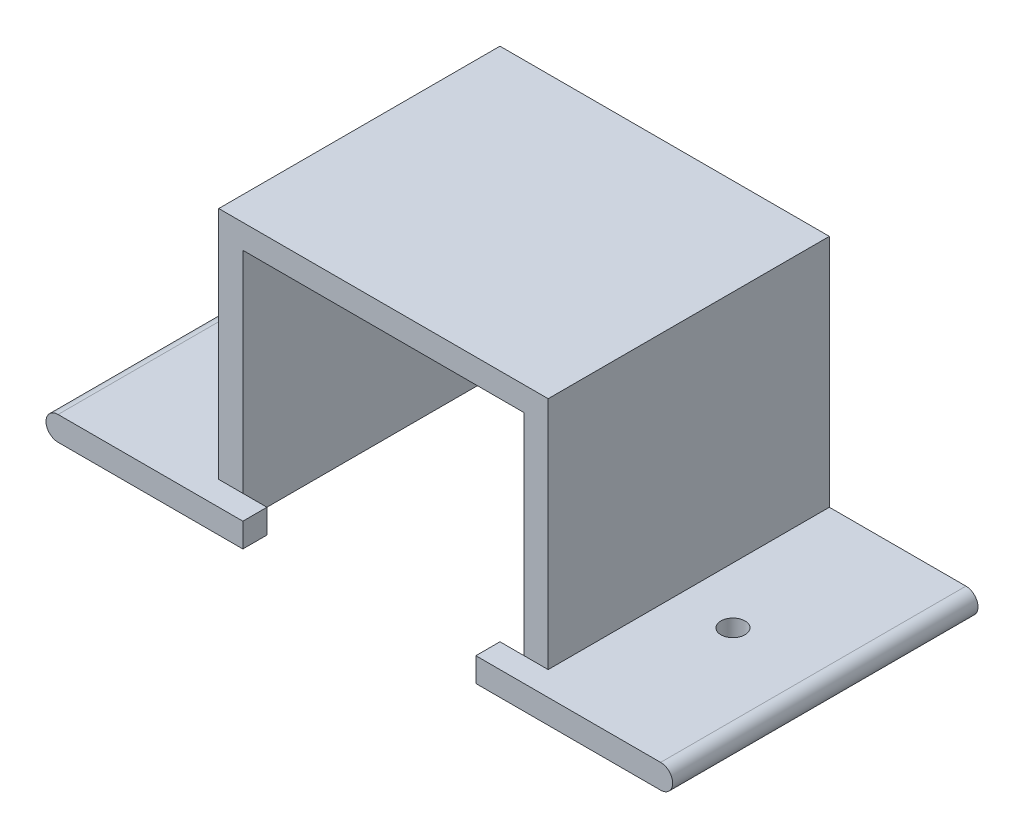
from build123d import *

# Parameters (mm, degrees)
BOSS_EXTRUDE1_DEPTH = 32
BOSS_EXTRUDE2_START = 3
BOSS_EXTRUDE2_DEPTH = 3
BOSS_EXTRUDE3_DEPTH = 3
SKETCH4_R           = 1.5
CUT_EXTRUDE1_DEPTH  = 4


with BuildPart() as part:
    # Sketch1 → Boss-Extrude1 (new body)
    with BuildSketch(Plane.XY):
        with BuildLine():
            Line((0, 0), (-20, 0))
            Line((-20, 0), (-20, 27.2))
            Line((-20, 27.2), (-20, 29.2))
            Line((-20, 29.2), (-55, 29.2))
            Line((-55, 29.2), (-55, 27.2))
            Line((-55, 27.2), (-55, 0))
            Line((-55, 0), (-75, 0))
            ThreePointArc((-75, 0), (-76.5, 1.5), (-75, 3))
            Line((-75, 3), (-58, 3))
            Line((-58, 3), (-58, 30.2))
            Line((-58, 30.2), (-58, 32.2))
            Line((-58, 32.2), (-17, 32.2))
            Line((-17, 32.2), (-17, 30.2))
            Line((-17, 30.2), (-17, 3))
            Line((-17, 3), (0, 3))
            ThreePointArc((0, 3), (1.5, 1.5), (0, 0))
        make_face()
    extrude(amount=BOSS_EXTRUDE1_DEPTH)

    # Sketch2 → Boss-Extrude2 (add)
    with BuildSketch(Plane(origin=(0, 0, 0), x_dir=(-1, 0, 0), z_dir=(0, 0, -1)).offset(BOSS_EXTRUDE2_START)):
        with BuildLine():
            Line((75, 0), (55, 0))
            Line((55, 0), (20, 0))
            Line((20, 0), (0, 0))
            ThreePointArc((0, 0), (-1.5, 1.5), (0, 3))
            Line((0, 3), (17, 3))
            Line((17, 3), (17, 32.2))
            Line((17, 32.2), (58, 32.2))
            Line((58, 32.2), (58, 3))
            Line((58, 3), (75, 3))
            ThreePointArc((75, 3), (76.5, 1.5), (75, 0))
        make_face()
    extrude(amount=-BOSS_EXTRUDE2_DEPTH)

    # Sketch3 → Boss-Extrude3 (add)
    with BuildSketch(Plane.XY.offset(32)):
        with BuildLine():
            Line((-20, 0), (-23, 0))
            Line((-23, 0), (-23, 3))
            Line((-23, 3), (-20, 3))
            Line((-20, 3), (0, 3))
            ThreePointArc((0, 3), (1.5, 1.5), (0, 0))
            Line((0, 0), (-20, 0))
        make_face()
        with BuildLine():
            Line((-55, 0), (-75, 0))
            ThreePointArc((-75, 0), (-76.5, 1.5), (-75, 3))
            Line((-75, 3), (-55, 3))
            Line((-55, 3), (-52, 3))
            Line((-52, 3), (-52, 0))
            Line((-52, 0), (-55, 0))
        make_face()
    extrude(amount=BOSS_EXTRUDE3_DEPTH)

    # Sketch4 → Cut-Extrude1 (cut)
    with BuildSketch(Plane.XZ):
        with Locations((-65, 16)):
            Circle(SKETCH4_R)
        with Locations((-10, 16)):
            Circle(SKETCH4_R)
    extrude(amount=-CUT_EXTRUDE1_DEPTH, mode=Mode.SUBTRACT)


solid = part.part
